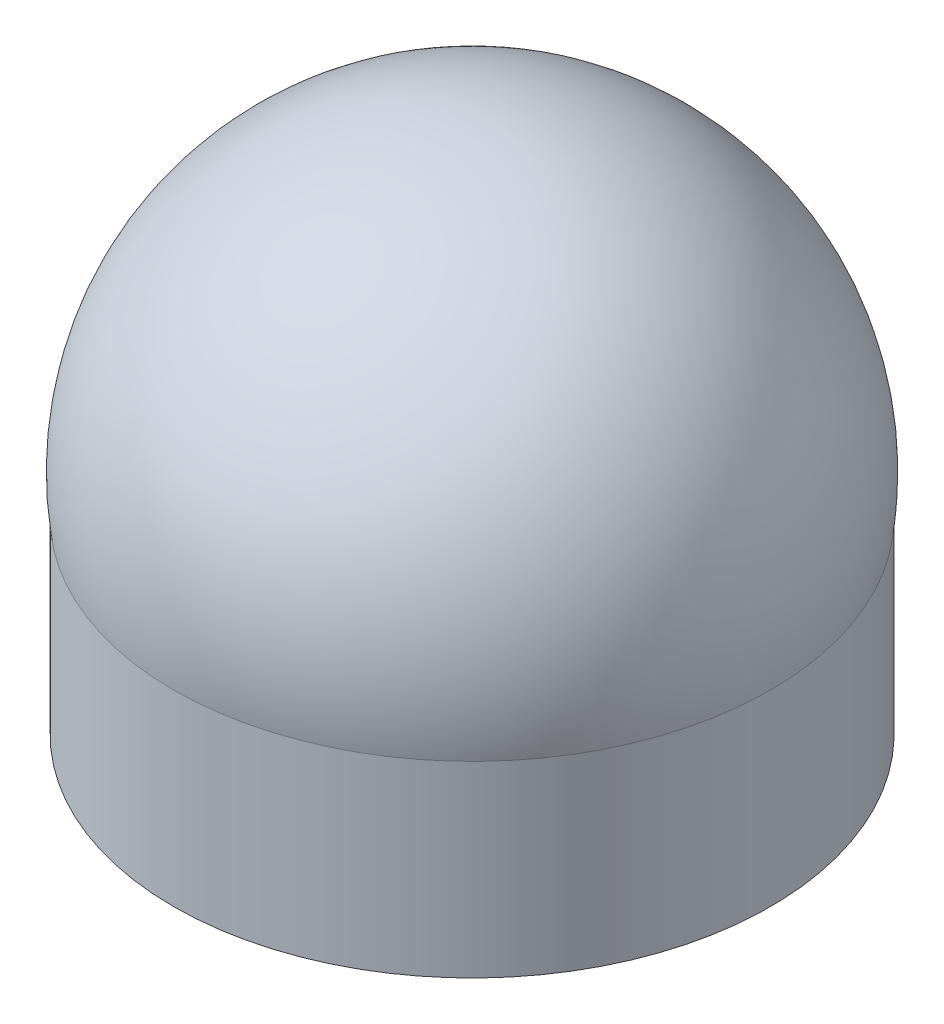
from build123d import *

# Parameters (mm, degrees)
SKETCH_1_R         = 8.75
EXTRUDE_1_DEPTH    = 5.5
DOME_1_FACE_RADIUS = 8.75
DOME_1_HEIGHT      = 10


# Read off the part's stored shape, not the designer's step: 抽壳1
with BuildPart() as part:
    # 草图1 → 凸台-拉伸1 (new body)
    with BuildSketch(Plane(origin=(0, 0, 0), x_dir=(1, 0, 0), z_dir=(0, 1, 0))):
        with Locations(Location((0, 0, 0), (0, 0, 270))):
            Circle(SKETCH_1_R)
    extrude(amount=EXTRUDE_1_DEPTH)

    # 圆顶1: a dome of height H over a round flat face of radius A is a cap of a sphere of radius (A * A + H * H) / (2 * H)
    dome_1_r = (DOME_1_FACE_RADIUS * DOME_1_FACE_RADIUS + DOME_1_HEIGHT * DOME_1_HEIGHT) / (2 * DOME_1_HEIGHT)
    dome_1_base = Plane((0, 5.5, 0), z_dir=(0, 1, 0))
    with Locations(dome_1_base.offset(DOME_1_HEIGHT - dome_1_r)):
        dome_1_ball = Sphere(dome_1_r, mode=Mode.PRIVATE)
    add(split(dome_1_ball, bisect_by=dome_1_base, keep=Keep.TOP, mode=Mode.PRIVATE))

    # 抽壳1 outline → 抽壳1 (revolve, cut)
    with BuildSketch(Plane.XY):
        with BuildLine():
            Line((0, 13.5), (0, 0))
            Line((0, 0), (6.75, 0))
            Line((6.75, 0), (6.75, 5.641927904))
            ThreePointArc((6.75, 5.641927904), (5.179570375, 11.12107063), (0, 13.5))
        make_face()
    revolve(axis=Axis((0, 0, 0), (0, 1, 0)), mode=Mode.SUBTRACT)


solid = part.part
